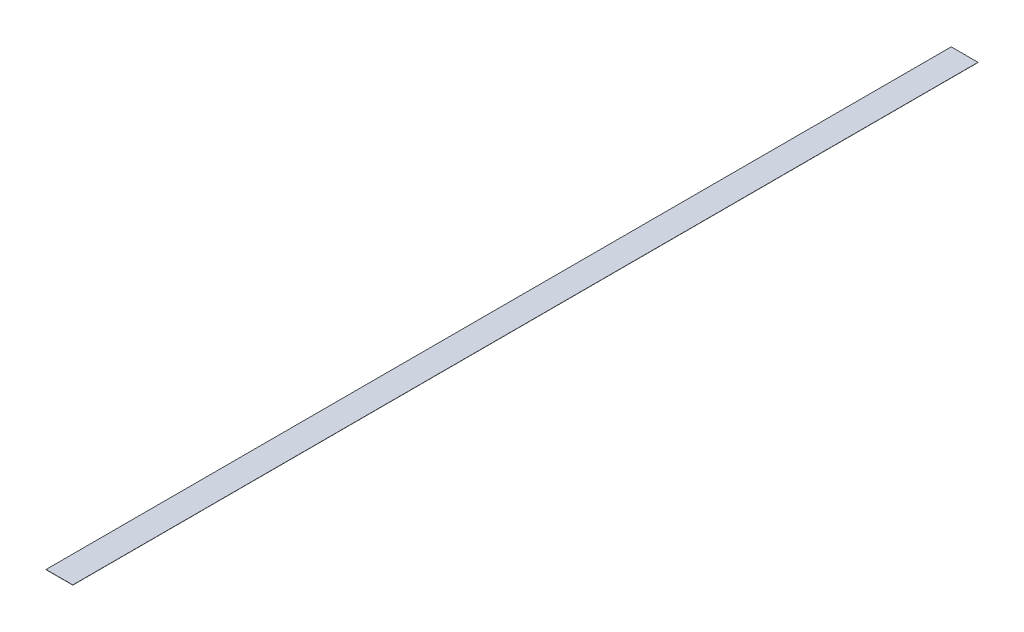
from build123d import *

# Parameters (mm, degrees)
SKETCH1_W           = 15
SKETCH1_H           = 507
BOSS_EXTRUDE1_DEPTH = 0.1


with BuildPart() as part:
    # Sketch1 → Boss-Extrude1 (new body)
    with BuildSketch(Plane(origin=(0, 0, 0), x_dir=(1, 0, 0), z_dir=(0, 1, 0))):
        with Locations((7.5, -253.5)):
            Rectangle(SKETCH1_W, SKETCH1_H)
    extrude(amount=BOSS_EXTRUDE1_DEPTH)


solid = part.part
